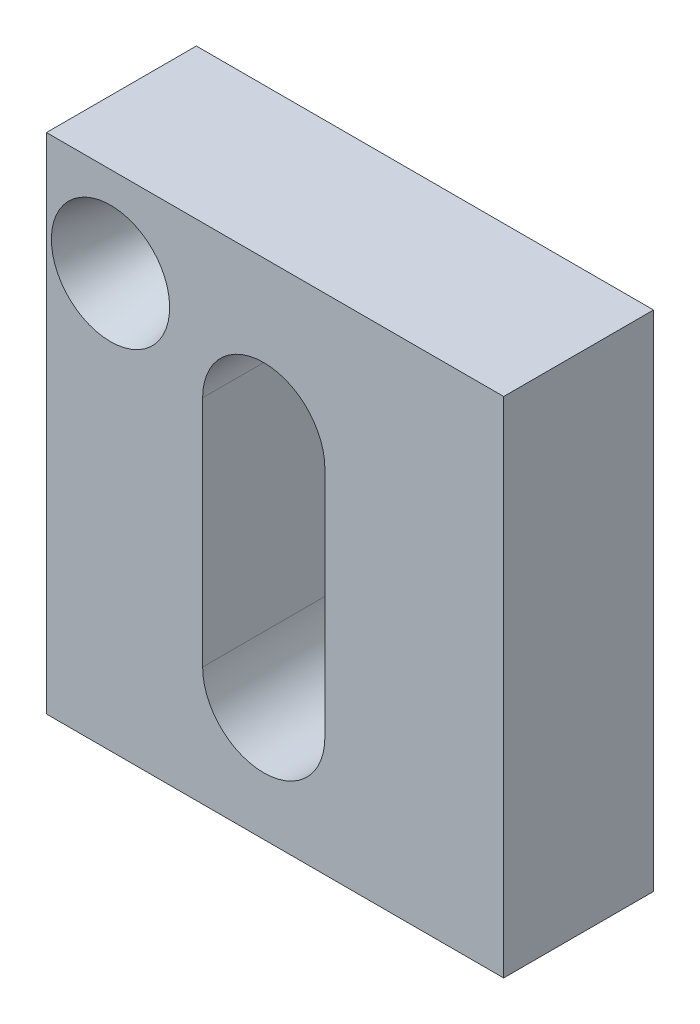
from build123d import *

# Parameters (mm, degrees)
SKETCH1_W           = 38.742575614
SKETCH1_H           = 42.674371655
BOSS_EXTRUDE1_DEPTH = 12.7


with BuildPart() as part:
    # Sketch1 → Boss-Extrude1 (new body)
    with BuildSketch(Plane.XY):
        with Locations((5.370258006, 21.337185828)):
            Rectangle(SKETCH1_W, SKETCH1_H)
        with BuildLine():
            Line((9.589746439, 29.824111426), (9.589746439, 10.069233761))
            ThreePointArc((9.589746439, 10.069233761), (4.411283362, 4.890770684), (-0.767179715, 10.069233761))
            Line((-0.767179715, 10.069233761), (-0.767179715, 29.824111426))
            ThreePointArc((-0.767179715, 29.824111426), (4.411283362, 35.002574503), (9.589746439, 29.824111426))
        make_face(mode=Mode.SUBTRACT)
    extrude(amount=BOSS_EXTRUDE1_DEPTH)

    # Cut-Loft1: read off the stored shape, not the designer's step
    # Cut-Loft1: loft between two sections, ruled curve by curve
    cut_loft1_from = [
        Edge.make_bspline([(-6.388735864, 35.417554769, 0), (-7.120249807, 39.787035762, 0), (-11.489730799, 39.055521819, 0), (-10.758216856, 34.686040826, 0), (-10.026702913, 30.316559834, 0), (-5.657221921, 31.048073777, 0), (-6.388735864, 35.417554769, 0)], [0, 0, 0, 0, 0.5, 0.5, 0.5, 1, 1, 1, 1], 3, [1, 0.333333333, 0.333333333, 1, 0.333333333, 0.333333333, 1]),
    ]
    cut_loft1_to = [
        Edge.make_bspline([(-4.568610902, 38.062672565, 12.7), (-10.590360438, 46.072403481, 12.7), (-18.600091353, 40.050653945, 12.7), (-12.578341818, 32.04092303, 12.7), (-6.556592282, 24.031192114, 12.7), (1.453138633, 30.05294165, 12.7), (-4.568610902, 38.062672565, 12.7)], [0, 0, 0, 0, 0.5, 0.5, 0.5, 1, 1, 1, 1], 3, [1, 0.333333333, 0.333333333, 1, 0.333333333, 0.333333333, 1]),
    ]
    cut_loft1 = Solid(Shell([*[Face.make_surface_from_curves(cut_loft1_from[k], cut_loft1_to[k]) for k in range(1)], Face(Wire(cut_loft1_from)), Face(Wire(cut_loft1_to))]))
    add(cut_loft1, mode=Mode.SUBTRACT)


solid = part.part
